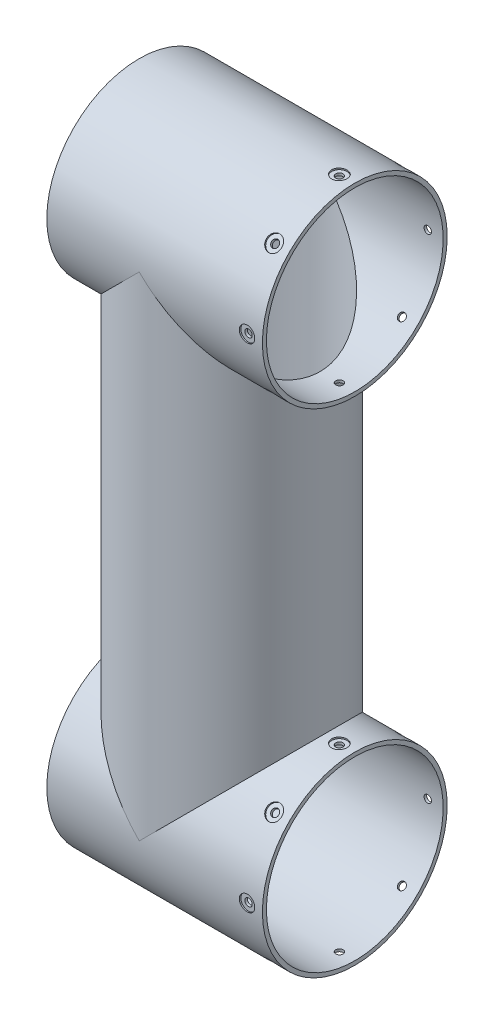
from build123d import *
from build123d.topology import SkipClean

# Parameters (mm, degrees)
SKETCH_1_R               = 30
EXTRUDE_1_DEPTH          = 160
EXTRUDE_START            = -30
SKETCH_2_R               = 30
EXTRUDE_2_DEPTH          = 70
SKETCH_3_R               = 28.7
CUT_EXTRUDE_1_DEPTH      = 178.200451467
PATTERN_CIRCULAR_1_COUNT = 8
SKETCH_4_R               = 28.7
CUT_EXTRUDE_2_DEPTH      = 160


with BuildPart() as part:
    # 스케치1 → 보스-돌출1 (new body)
    with BuildSketch(Plane(origin=(0, 0, 0), x_dir=(1, 0, 0), z_dir=(0, 1, 0))):
        Circle(SKETCH_1_R)
    extrude(amount=EXTRUDE_1_DEPTH)

    # 스케치2 → 보스-돌출2 (add)
    with SkipClean():  # the faces are left unmerged after this step: merging them gives an invalid solid
        with BuildSketch(Plane(origin=(0, 0, 0), x_dir=(0, 0, -1), z_dir=(1, 0, 0)).offset(EXTRUDE_START)):
            Circle(SKETCH_2_R)
        extrude_2 = extrude(amount=EXTRUDE_2_DEPTH)

    # 스케치3 → 컷-돌출1 (cut, through all)
    with SkipClean():  # the faces are left unmerged after this step: merging them gives an invalid solid
        with BuildSketch(Plane.ZY.offset(30)):
            Circle(SKETCH_3_R)
        cut_extrude_1 = extrude(amount=-CUT_EXTRUDE_1_DEPTH, mode=Mode.SUBTRACT)

    # 스케치7 → M2 남비 머리 나사용 카운터보어1 (revolve, cut)
    with SkipClean():  # the faces are left unmerged after this step: merging them gives an invalid solid
        with BuildSketch(Plane(origin=(35, 0, -30), x_dir=(0, 1, 0), z_dir=(1, 0, 0))):
            Polygon((0, 0), (0, 10.721032743), (1.2, 10), (1.2, 0.5), (2.5, 0.5), (2.5, 0), align=None)
        hole_wizard_m2_1 = revolve(axis=Axis((35, 0, -36.35), (0, 0, 1)), mode=Mode.SUBTRACT)

    # 원형 패턴1: M2 남비 머리 나사용 카운터보어1 ×8 about axis
    with SkipClean():  # the faces are left unmerged after this step: merging them gives an invalid solid
        pattern_circular_1_axis = Axis((40, 0, 0), (1, 0, 0))
        for i in range(1, PATTERN_CIRCULAR_1_COUNT):
            add(hole_wizard_m2_1.rotate(pattern_circular_1_axis, i * 360 / PATTERN_CIRCULAR_1_COUNT), mode=Mode.SUBTRACT)

    # 대칭 복사2: 보스-돌출2, 컷-돌출1, M2 남비 머리 나사용 카운터보어1 across plane
    with SkipClean():  # the faces are left unmerged after this step: merging them gives an invalid solid
        add(extrude_2.mirror(Plane.ZX.offset(80)))
        add(cut_extrude_1.mirror(Plane.ZX.offset(80)), mode=Mode.SUBTRACT)
        add(hole_wizard_m2_1.mirror(Plane.ZX.offset(80)), mode=Mode.SUBTRACT)

    # 대칭 복사2 copy 1 sketch → 대칭 복사2 copy 1 (revolve, cut)
    with SkipClean():  # the faces are left unmerged after this step: merging them gives an invalid solid
        with BuildSketch(Plane(origin=(35, 138.786796564, -21.213203436), x_dir=(0, -0.7071067811865476, 0.7071067811865475), z_dir=(1, 0, 0))):
            Polygon((0, 0), (0, -10.721032743), (1.2, -10), (1.2, -0.5), (2.5, -0.5), (2.5, 0), align=None)
        revolve(axis=Axis((35, 134.296668504, -25.703331496), (0, -0.7071067811865475, -0.7071067811865476)), mode=Mode.SUBTRACT)

    # 대칭 복사2 copy 2 sketch → 대칭 복사2 copy 2 (revolve, cut)
    with SkipClean():  # the faces are left unmerged after this step: merging them gives an invalid solid
        with BuildSketch(Plane(origin=(35, 130, 0), x_dir=(0, 0, 1), z_dir=(1, 0, 0))):
            Polygon((0, 0), (0, -10.721032743), (1.2, -10), (1.2, -0.5), (2.5, -0.5), (2.5, 0), align=None)
        revolve(axis=Axis((35, 123.65, 0), (0, -1, 0)), mode=Mode.SUBTRACT)

    # 대칭 복사2 copy 3 sketch → 대칭 복사2 copy 3 (revolve, cut)
    with SkipClean():  # the faces are left unmerged after this step: merging them gives an invalid solid
        with BuildSketch(Plane(origin=(35, 138.786796564, 21.213203436), x_dir=(0, 0.7071067811865475, 0.7071067811865476), z_dir=(1, 0, 0))):
            Polygon((0, 0), (0, -10.721032743), (1.2, -10), (1.2, -0.5), (2.5, -0.5), (2.5, 0), align=None)
        revolve(axis=Axis((35, 134.296668504, 25.703331496), (0, -0.7071067811865476, 0.7071067811865475)), mode=Mode.SUBTRACT)

    # 대칭 복사2 copy 4 sketch → 대칭 복사2 copy 4 (revolve, cut)
    with SkipClean():  # the faces are left unmerged after this step: merging them gives an invalid solid
        with BuildSketch(Plane(origin=(35, 160, 30), x_dir=(0, 1, 0), z_dir=(1, 0, 0))):
            Polygon((0, 0), (0, -10.721032743), (1.2, -10), (1.2, -0.5), (2.5, -0.5), (2.5, 0), align=None)
        revolve(axis=Axis((35, 160, 36.35), (0, 0, 1)), mode=Mode.SUBTRACT)

    # 대칭 복사2 copy 5 sketch → 대칭 복사2 copy 5 (revolve, cut)
    with SkipClean():  # the faces are left unmerged after this step: merging them gives an invalid solid
        with BuildSketch(Plane(origin=(35, 181.213203436, 21.213203436), x_dir=(0, 0.7071067811865477, -0.7071067811865475), z_dir=(1, 0, 0))):
            Polygon((0, 0), (0, -10.721032743), (1.2, -10), (1.2, -0.5), (2.5, -0.5), (2.5, 0), align=None)
        revolve(axis=Axis((35, 185.703331496, 25.703331496), (0, 0.7071067811865475, 0.7071067811865477)), mode=Mode.SUBTRACT)

    # 대칭 복사2 copy 6 sketch → 대칭 복사2 copy 6 (revolve, cut)
    with SkipClean():  # the faces are left unmerged after this step: merging them gives an invalid solid
        with BuildSketch(Plane(origin=(35, 190, 0), x_dir=(0, 0, -1), z_dir=(1, 0, 0))):
            Polygon((0, 0), (0, -10.721032743), (1.2, -10), (1.2, -0.5), (2.5, -0.5), (2.5, 0), align=None)
        revolve(axis=Axis((35, 196.35, 0), (0, 1, 0)), mode=Mode.SUBTRACT)

    # 대칭 복사2 copy 7 sketch → 대칭 복사2 copy 7 (revolve, cut)
    with SkipClean():  # the faces are left unmerged after this step: merging them gives an invalid solid
        with BuildSketch(Plane(origin=(35, 181.213203436, -21.213203436), x_dir=(0, -0.7071067811865474, -0.7071067811865477), z_dir=(1, 0, 0))):
            Polygon((0, 0), (0, -10.721032743), (1.2, -10), (1.2, -0.5), (2.5, -0.5), (2.5, 0), align=None)
        revolve(axis=Axis((35, 185.703331496, -25.703331496), (0, 0.7071067811865477, -0.7071067811865474)), mode=Mode.SUBTRACT)

    # 스케치4 → 컷-돌출2 (cut)
    with SkipClean():  # the faces are left unmerged after this step: merging them gives an invalid solid
        with BuildSketch(Plane(origin=(0, 160, 0), x_dir=(1, 0, 0), z_dir=(0, 1, 0))):
            Circle(SKETCH_4_R)
        extrude(amount=-CUT_EXTRUDE_2_DEPTH, mode=Mode.SUBTRACT)


solid = part.part
